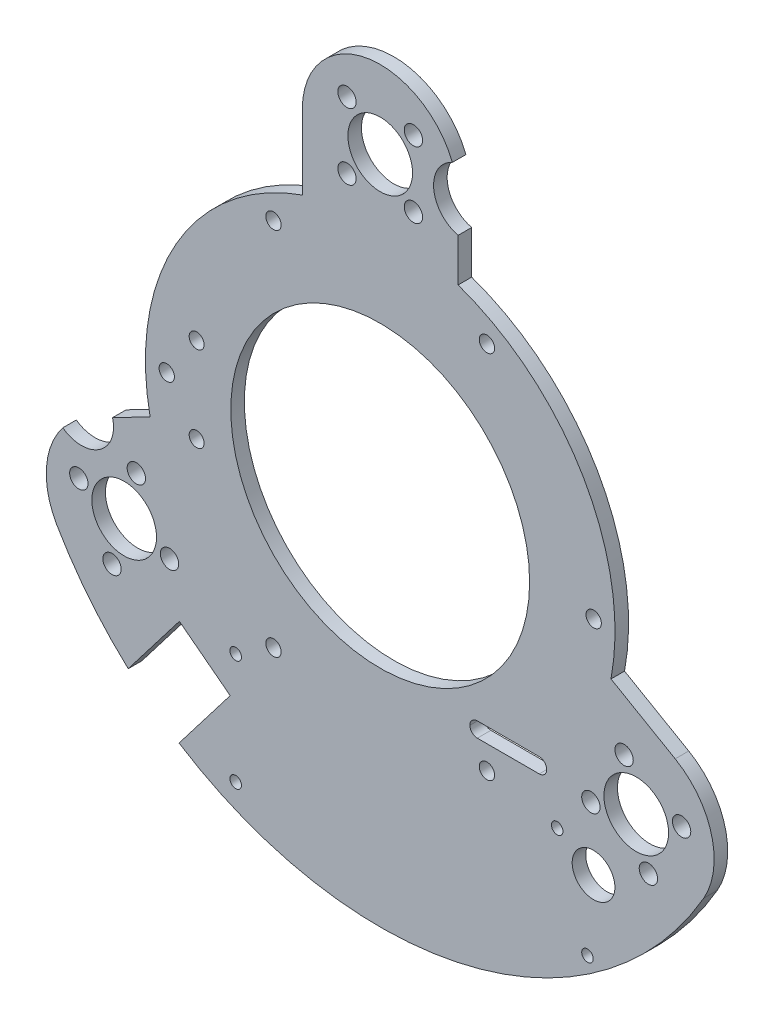
from build123d import *

# Parameters (mm, degrees)
SKETCH1_R           = 2.150000002
SKETCH1_R_2         = 35
SKETCH1_R_3         = 1.8
SKETCH1_R_4         = 7.575
BOSS_EXTRUDE1_DEPTH = 3.175
SKETCH3_R           = 1.35
SKETCH3_R_2         = 5
SKETCH3_W           = 18
SKETCH3_H           = 3.5
CUT_EXTRUDE1_DEPTH  = 3.175
CUT_EXTRUDE2_DEPTH  = 3.175
SKETCH6_R           = 7.5
CUT_EXTRUDE5_DEPTH  = 10
FILLET1_R           = 1.75
SKETCH7_R           = 1.75
CUT_EXTRUDE6_DEPTH  = 10


with BuildPart() as part:
    # Sketch1 → Boss-Extrude1 (new body)
    with BuildSketch(Plane.XY):
        with BuildLine():
            Line((69.097259206, -18.820036388), (54.057762213, -10.136978751))
            ThreePointArc((54.057762213, -10.136978751), (47.631397163, 27.499999965), (18.250000006, 51.883884719))
            Line((18.250000006, 51.883884719), (18.250000006, 69.249999994))
            ThreePointArc((18.250000006, 69.249999994), (6e-09, 87.499999994), (-18.249999994, 69.249999994))
            Line((-18.249999994, 69.249999994), (-18.249999994, 51.883884717))
            ThreePointArc((-18.249999994, 51.883884717), (-47.836716311, 27.141270525), (-53.899300523, -10.948305635))
            Line((-53.899300523, -10.948305635), (-69.097259204, -18.820036383))
            ThreePointArc((-69.097259204, -18.820036383), (-77.600405532, -29.901552426), (-75.777222821, -43.749999994))
            ThreePointArc((-75.777222821, -43.749999994), (0, -87.499999989), (75.777222821, -43.749999994))
            ThreePointArc((75.777222821, -43.749999994), (77.60040553, -29.901552429), (69.097259206, -18.820036388))
        make_face()
        with Locations((-7.778174593, 77.028174587)):
            Circle(SKETCH1_R, mode=Mode.SUBTRACT)
        Circle(SKETCH1_R_2, mode=Mode.SUBTRACT)
        with Locations((-50, 0)):
            Circle(SKETCH1_R_3, mode=Mode.SUBTRACT)
        with Locations((-25, 43.301270189)):
            Circle(SKETCH1_R_3, mode=Mode.SUBTRACT)
        with Locations((25, 43.301270189)):
            Circle(SKETCH1_R_3, mode=Mode.SUBTRACT)
        with Locations((50, 0)):
            Circle(SKETCH1_R_3, mode=Mode.SUBTRACT)
        with Locations((25, -43.301270189)):
            Circle(SKETCH1_R_3, mode=Mode.SUBTRACT)
        with Locations((-25, -43.301270189)):
            Circle(SKETCH1_R_3, mode=Mode.SUBTRACT)
        with Locations((7.778174587, 77.028174593)):
            Circle(SKETCH1_R, mode=Mode.SUBTRACT)
        with Locations((7.778174593, 61.471825413)):
            Circle(SKETCH1_R, mode=Mode.SUBTRACT)
        with Locations((-7.778174587, 61.471825407)):
            Circle(SKETCH1_R, mode=Mode.SUBTRACT)
        with Locations((62.819268711, -45.250184084)):
            Circle(SKETCH1_R, mode=Mode.SUBTRACT)
        with Locations((49.347075128, -37.472009499)):
            Circle(SKETCH1_R, mode=Mode.SUBTRACT)
        with Locations((57.125249713, -23.999815916)):
            Circle(SKETCH1_R, mode=Mode.SUBTRACT)
        with Locations((70.597443296, -31.777990501)):
            Circle(SKETCH1_R, mode=Mode.SUBTRACT)
        with Locations((-70.597443298, -31.777990509)):
            Circle(SKETCH1_R, mode=Mode.SUBTRACT)
        with Locations((-57.125249721, -23.999815914)):
            Circle(SKETCH1_R, mode=Mode.SUBTRACT)
        with Locations((-49.347075126, -37.472009491)):
            Circle(SKETCH1_R, mode=Mode.SUBTRACT)
        with Locations((-62.819268703, -45.250184086)):
            Circle(SKETCH1_R, mode=Mode.SUBTRACT)
        with Locations((0, 69.249999994)):
            Circle(SKETCH1_R_4, mode=Mode.SUBTRACT)
        with Locations((59.972259207, -34.624999997)):
            Circle(SKETCH1_R_4, mode=Mode.SUBTRACT)
        with Locations((-59.972259207, -34.624999997)):
            Circle(SKETCH1_R_4, mode=Mode.SUBTRACT)
    extrude(amount=BOSS_EXTRUDE1_DEPTH)

    # Sketch3 → Cut-Extrude1 (cut)
    with BuildSketch(Plane.XY.offset(3.175)):
        with Locations((-33.85, -49)):
            Circle(SKETCH3_R)
        with Locations((-33.85, -75)):
            Circle(SKETCH3_R)
        with Locations((41.45, -46.7)):
            Circle(SKETCH3_R)
        with Locations((49.972259207, -51.945508073)):
            Circle(SKETCH3_R_2)
        with Locations((48.55, -69)):
            Circle(SKETCH3_R)
        with Locations((30, -36.05)):
            Rectangle(SKETCH3_W, SKETCH3_H)
    extrude(amount=-CUT_EXTRUDE1_DEPTH, mode=Mode.SUBTRACT)

    # Sketch4 → Cut-Extrude2 (cut)
    with BuildSketch(Plane.XY.offset(3.175)):
        Polygon((-18.902035191, 65.231994187), (-24.642286676, 79.090187175), (-38.500479664, 73.349935689), (-32.760228178, 59.491742702), align=None)
        Polygon((-47.04154651, -48.985639752), (-56.172967945, -60.885939856), (-63.507557332, -70.444562845), (-51.607257228, -79.57598428), (-44.272667841, -70.017361292), (-35.141246406, -58.117061187), align=None)
        Polygon((65.943581701, -16.246354435), (80.815254622, -18.204247318), (82.773147505, -3.332574398), (67.901474584, -1.374681515), align=None)
    extrude(amount=-CUT_EXTRUDE2_DEPTH, mode=Mode.SUBTRACT)

    # Sketch6 → Cut-Extrude5 (cut)
    with BuildSketch(Plane.XY):
        with Locations((20, 69.25)):
            Circle(SKETCH6_R)
        with Locations((-69.972259212, -17.304491924)):
            Circle(SKETCH6_R)
    extrude(amount=CUT_EXTRUDE5_DEPTH, mode=Mode.SUBTRACT)

    # Fillet1
    fillet1_edges = [part.edges().sort_by_distance(p)[0] for p in [
        (21, -37.8, 1.5875),
        (39, -37.8, 1.5875),
        (39, -34.3, 1.5875),
        (21, -34.3, 1.5875),
    ]]
    fillet(fillet1_edges, radius=FILLET1_R - 0.0001)  # a hair under: the kernel refuses the full size

    # Sketch7 → Cut-Extrude6 (cut)
    with BuildSketch(Plane.XY.offset(3.175)):
        with Locations((-43, 10)):
            Circle(SKETCH7_R)
        with Locations((-43, -10)):
            Circle(SKETCH7_R)
    extrude(amount=-CUT_EXTRUDE6_DEPTH, mode=Mode.SUBTRACT)


solid = part.part
